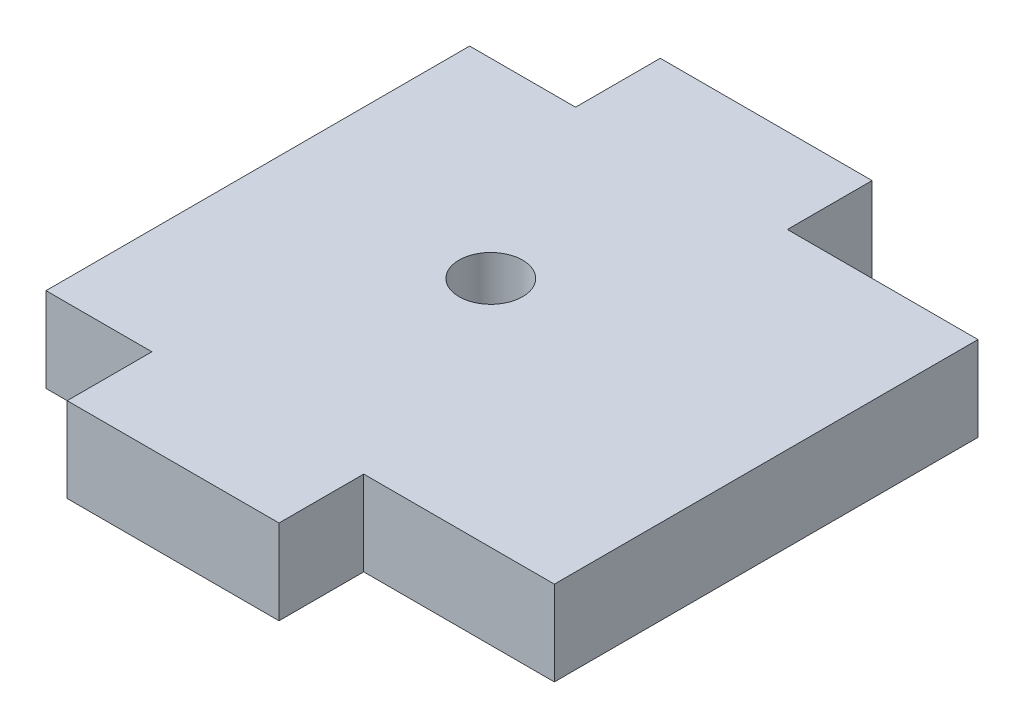
from build123d import *

# Parameters (mm, degrees)
SKETCH1_R           = 1.5
BOSS_EXTRUDE2_DEPTH = 4


with BuildPart() as part:
    # Sketch1 → Boss-Extrude2 (new body)
    with BuildSketch(Plane(origin=(0, 0, 0), x_dir=(1, 0, 0), z_dir=(0, 1, 0))):
        Polygon((15, 20), (24, 20), (24, 0), (15, 0), (15, -4), (5, -4), (5, 0), (0, 0), (0, 20), (5, 20), (5, 24), (15, 24), align=None)
        with Locations((10, 11)):
            Circle(SKETCH1_R, mode=Mode.SUBTRACT)
    extrude(amount=BOSS_EXTRUDE2_DEPTH)


solid = part.part
